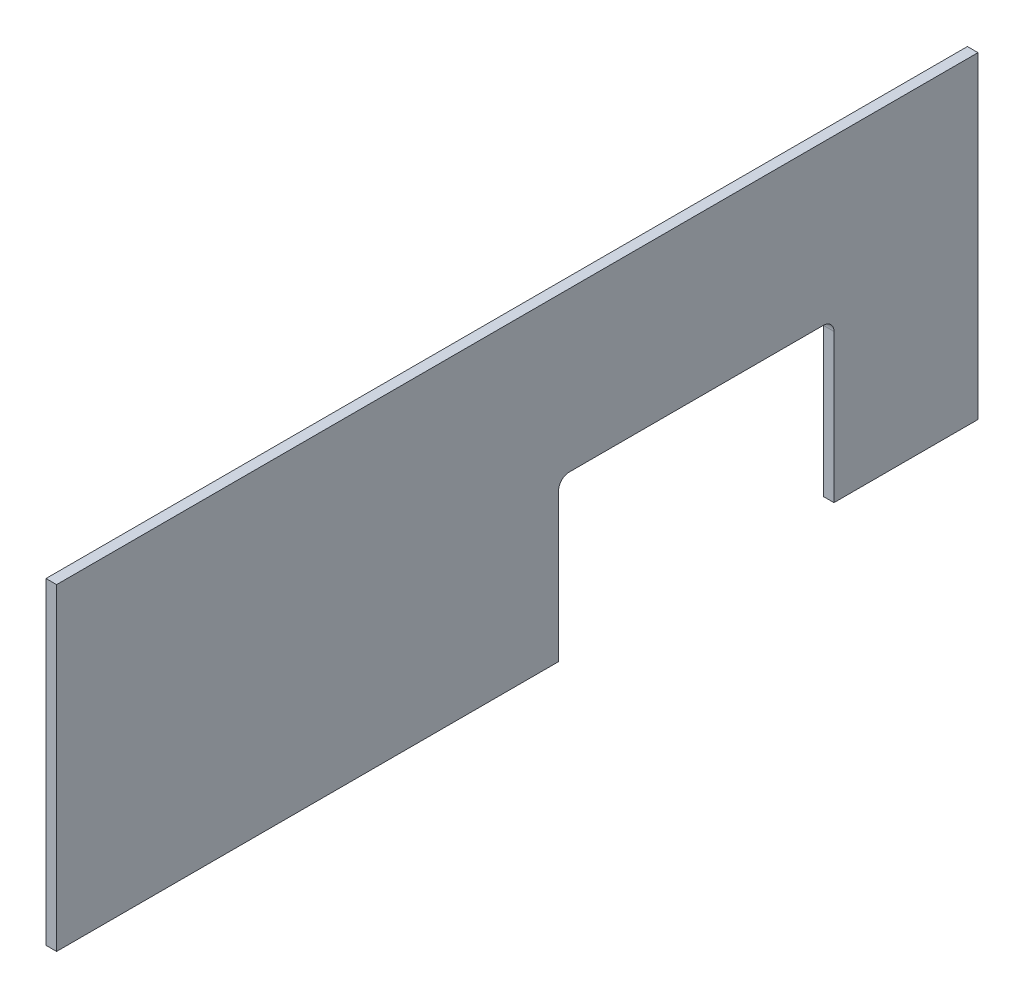
from build123d import *

# Parameters (mm, degrees)
BOSS_EXTRUDE1_DEPTH = 1
FILLET1_R           = 1


with BuildPart() as part:
    # Sketch1 → Boss-Extrude1 (new body)
    with BuildSketch(Plane(origin=(0, 0, 0), x_dir=(0, 0, -1), z_dir=(1, 0, 0))):
        Polygon((-43.5, 15), (-43.5, -15), (3.9, -15), (3.9, 0), (29.9, 0), (29.9, -15), (43.5, -15), (43.5, 15), align=None)
    extrude(amount=BOSS_EXTRUDE1_DEPTH)

    # Fillet1
    fillet1_edges = [part.edges().sort_by_distance(p)[0] for p in [
        (0.5, 0, -29.9),
        (0.5, 0, -3.9),
    ]]
    fillet(fillet1_edges, radius=FILLET1_R)


solid = part.part
